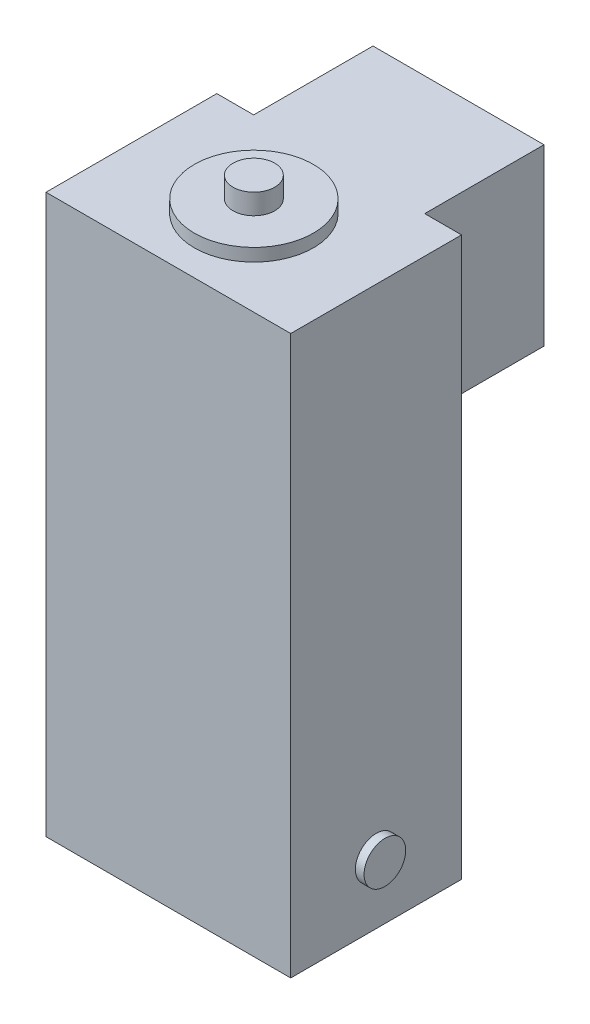
from build123d import *

# Parameters (mm, degrees)
SKETCH1_W                 = 46
SKETCH1_H                 = 40.2
BOSS_EXTRUDE1_DEPTH       = 65.1
SKETCH3_R                 = 14
BOSS_EXTRUDE2_DEPTH       = 3
SKETCH4_R                 = 4.9
BOSS_EXTRUDE3_DEPTH       = 4.8
SKETCH7_W                 = 40.2
SKETCH7_H                 = 35.4
BOSS_EXTRUDE6_DEPTH       = 1
CHAMFER1_SIZE             = 6
CHAMFER1_SIZE2            = 5.1
MIRROR3_START             = 44.200099823
MIRROR3_OUTLINE_W         = 50
MIRROR3_OUTLINE_H         = 11
MIRROR3_DEPTH             = 3.885890521
CHAMFER1_OF_MIRROR8_SIZE2 = 5.1
CHAMFER1_OF_MIRROR8_SIZE  = 6
BOSS_EXTRUDE7_DEPTH       = 4.7625
SKETCH9_W                 = 40.2
SKETCH9_H                 = 61.1
BOSS_EXTRUDE8_DEPTH       = 41
SKETCH10_W                = 38
SKETCH10_H                = 38
BOSS_EXTRUDE9_DEPTH       = 9.3
SKETCH11_R                = 14
BOSS_EXTRUDE10_DEPTH      = 3
SKETCH12_R                = 4.9
BOSS_EXTRUDE11_DEPTH      = 4.8
BOSS_EXTRUDE12_REACH      = 145.093
SKETCH13_W                = 57.525
SKETCH13_H                = 40.156919592


# Read off the part's stored shape, not the designer's step: Mirror3
with BuildPart() as part:
    # Sketch1 → Boss-Extrude1 (new body)
    with BuildSketch(Plane(origin=(0, -14.5, 0), x_dir=(-1, 0, 0), z_dir=(0, 1, 0))):
        Rectangle(SKETCH1_W, SKETCH1_H)
    extrude(amount=BOSS_EXTRUDE1_DEPTH)

    # Sketch3 → Boss-Extrude2 (add)
    with BuildSketch(Plane.ZY.offset(-23)):
        Circle(SKETCH3_R)
    extrude(amount=-BOSS_EXTRUDE2_DEPTH)

    # Sketch4 → Boss-Extrude3 (add)
    with BuildSketch(Plane(origin=(26, 0, 0), x_dir=(0, 0, -1), z_dir=(1, 0, 0))):
        with Locations(Location((0, 0, 0), (0, 0, 180))):
            Circle(SKETCH4_R)
    extrude(amount=BOSS_EXTRUDE3_DEPTH)

    # Sketch7 → Boss-Extrude6 (add)
    with BuildSketch(Plane.ZY.offset(23)):
        with Locations((0, 32.9)):
            Rectangle(SKETCH7_W, SKETCH7_H)
    boss_extrude6 = extrude(amount=BOSS_EXTRUDE6_DEPTH)

    # Mirror1: Boss-Extrude6 across plane
    add(boss_extrude6.mirror(Plane(origin=(0, 0, 0), x_dir=(0, 0, 1), z_dir=(1, 0, 0))))

    # Chamfer1
    chamfer1_edges = [part.edges().sort_by_distance(p)[0] for p in [
        (0, 50.6, 20.1),
    ]]
    chamfer1_side = [part.faces().sort_by_distance(p)[0] for p in [
        (0, 18.392982971, 20.1),
    ]]
    chamfer(chamfer1_edges, length=CHAMFER1_SIZE, length2=CHAMFER1_SIZE2, reference=chamfer1_side[0])

    # Mirror3 outline → Mirror3 (cut)
    with BuildSketch(Plane(origin=(0, 0, 0), x_dir=(1, 0, 0), z_dir=(0, 0.6476484200955404, -0.7619393177594594)).offset(MIRROR3_START)):
        with Locations((0, -24.5)):
            Rectangle(MIRROR3_OUTLINE_W, MIRROR3_OUTLINE_H)
    mirror3 = extrude(amount=MIRROR3_DEPTH, mode=Mode.SUBTRACT)

    # Mirror8: Mirror3 across plane
    add(mirror3.mirror(Plane.ZX.offset(18.05)), mode=Mode.SUBTRACT)

    # Chamfer1 of Mirror8
    chamfer1_of_mirror8_edges = [part.edges().sort_by_distance(p)[0] for p in [
        (0, -14.5, 20.1),
    ]]
    chamfer(chamfer1_of_mirror8_edges, length=CHAMFER1_OF_MIRROR8_SIZE, length2=CHAMFER1_OF_MIRROR8_SIZE2)

    # Sketch8 → Boss-Extrude7 (add)
    with BuildSketch(Plane(origin=(24, 0, 0), x_dir=(0, 0, -1), z_dir=(1, 0, 0))):
        Polygon((20.1, 15.2), (8.9, 15.2), (-20.1, 31.2), (-20.1, 115.2), (8.9, 115.2), (8.9, 57.776470588), (20.1, 44.6), align=None)
    boss_extrude7 = extrude(amount=BOSS_EXTRUDE7_DEPTH)

    # Mirror4: Boss-Extrude7 across plane
    add(boss_extrude7.mirror(Plane(origin=(0, 0, 0), x_dir=(0, 0, 1), z_dir=(1, 0, 0))))



with BuildPart() as body_2:
    # Sketch9 → Boss-Extrude8 (new body)
    with BuildSketch(Plane(origin=(0, 116.7, 0), x_dir=(-1, 0, 0), z_dir=(0, 1, 0))):
        with Locations((0, -17.55)):
            Rectangle(SKETCH9_W, SKETCH9_H)
    extrude(amount=-BOSS_EXTRUDE8_DEPTH)


with BuildPart() as part_1:
    add(part.part)

    add(body_2.part)  # Boss-Extrude9 merges body 2
    # Sketch10 → Boss-Extrude9 (add)
    with BuildSketch(Plane.ZY.offset(-24)):
        with Locations((1.1, 96.2)):
            Rectangle(SKETCH10_W, SKETCH10_H)
    boss_extrude9 = extrude(amount=BOSS_EXTRUDE9_DEPTH)

    # Mirror6: Boss-Extrude9 across plane
    add(boss_extrude9.mirror(Plane(origin=(0, 0, 0), x_dir=(0, 0, 1), z_dir=(1, 0, 0))))

    # Sketch11 → Boss-Extrude10 (add)
    with BuildSketch(Plane(origin=(0, 116.7, 0), x_dir=(-1, 0, 0), z_dir=(0, 1, 0))):
        with Locations(Location((0, 0, 0), (0, 0, 68.213210702))):
            Circle(SKETCH11_R)
    extrude(amount=BOSS_EXTRUDE10_DEPTH)

    # Sketch12 → Boss-Extrude11 (add)
    with BuildSketch(Plane(origin=(0, 119.7, 0), x_dir=(1, 0, 0), z_dir=(0, 1, 0))):
        with Locations(Location((0, 0, 0), (0, 0, 270))):
            Circle(SKETCH12_R)
    extrude(amount=BOSS_EXTRUDE11_DEPTH)

    # Boss-Extrude12: up to this face of the body (flat: up to its plane)
    boss_extrude12_end = Plane(part_1.part.faces().sort_by_distance((0, -14.5, 0))[0])
    # Sketch13 → Boss-Extrude12 (add, up to the picked face)
    with BuildSketch(Plane(origin=(0, 116.7, 0), x_dir=(1, 0, 0), z_dir=(0, 1, 0)), mode=Mode.PRIVATE) as boss_extrude12_sk1:
        with Locations((0, -0.021540204)):
            Rectangle(SKETCH13_W, SKETCH13_H)
    boss_extrude12_tool1 = split(extrude(boss_extrude12_sk1.sketch, amount=-BOSS_EXTRUDE12_REACH, mode=Mode.PRIVATE), bisect_by=boss_extrude12_end, keep=Keep.BOTH, mode=Mode.PRIVATE)
    add(boss_extrude12_tool1.solids().sort_by(Axis((0, 116.7, 0.02154), (0, -1, 0)))[0])


solid = part_1.part
